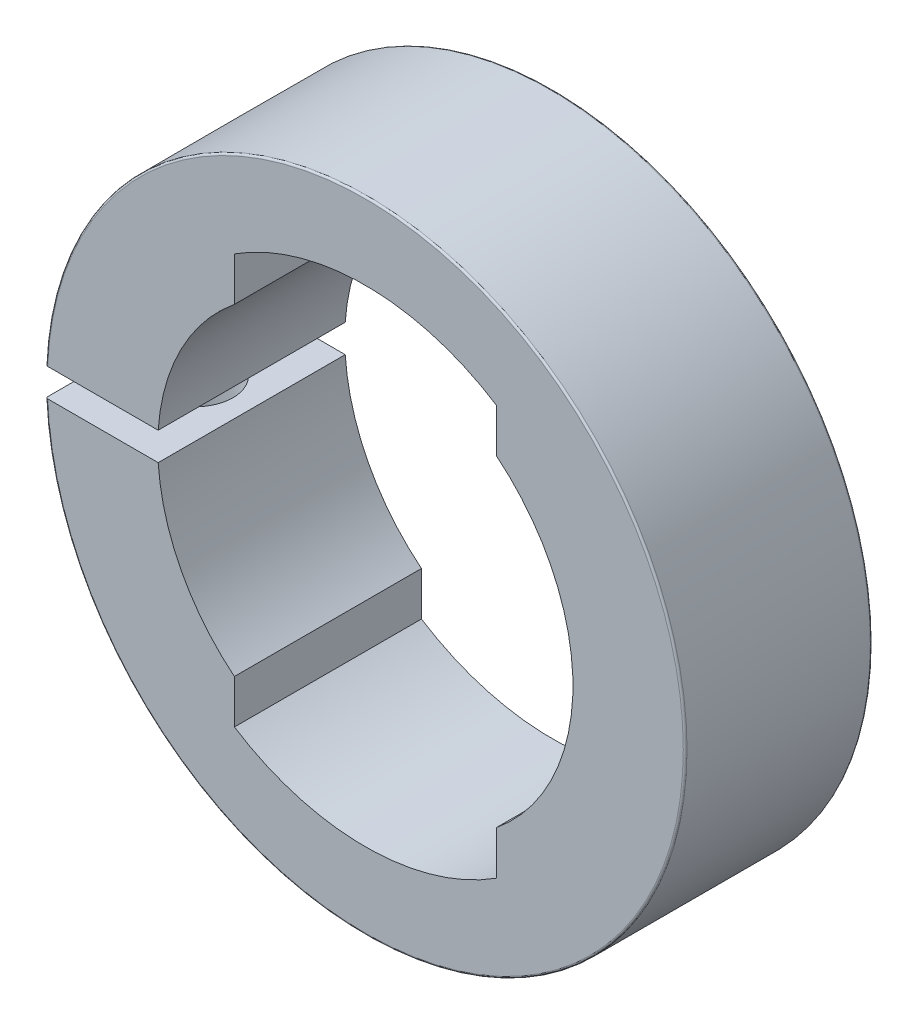
from build123d import *

# Parameters (mm, degrees)
BOSS_EXTRUDE1_DEPTH     = 10
CUT_EXTRUDE1_DEPTH      = 27.665192668
CUT_EXTRUDE1_DEPTH_BACK = 27.665192668
SKETCH2_R               = 2
FILLET1_R               = 0.1


with BuildPart() as part:
    # Sketch1 → Boss-Extrude1 (new body)
    with BuildSketch(Plane.XY):
        with BuildLine():
            Line((-7, 10.95445115), (-7, 8.614522622))
            ThreePointArc((-7, 8.614522622), (-9.855748076, 5.106293163), (-11.074633177, 0.75))
            Line((-11.074633177, 0.75), (-17.083544714, 0.75))
            ThreePointArc((-17.083544714, 0.75), (17.1, 0), (-17.083544714, -0.75))
            Line((-17.083544714, -0.75), (-11.074633177, -0.75))
            ThreePointArc((-11.074633177, -0.75), (-9.855748076, -5.106293163), (-7, -8.614522622))
            Line((-7, -8.614522622), (-7, -10.95445115))
            ThreePointArc((-7, -10.95445115), (0, -13), (7, -10.95445115))
            Line((7, -10.95445115), (7, -8.614522622))
            ThreePointArc((7, -8.614522622), (11.1, 0), (7, 8.614522622))
            Line((7, 8.614522622), (7, 10.95445115))
            ThreePointArc((7, 10.95445115), (0, 13), (-7, 10.95445115))
        make_face()
    extrude(amount=BOSS_EXTRUDE1_DEPTH)

    # Sketch2 → Cut-Extrude1 (cut, two sides: drawn at the far end of the back side and taken through both)
    with BuildSketch(Plane(origin=(0, -0.75, 0), x_dir=(1, 0, 0), z_dir=(0, 1, 0)).offset(-CUT_EXTRUDE1_DEPTH_BACK)):
        with Locations((-14.079088945, -5)):
            Circle(SKETCH2_R)
    extrude(amount=CUT_EXTRUDE1_DEPTH + CUT_EXTRUDE1_DEPTH_BACK, mode=Mode.SUBTRACT)

    # Fillet1
    fillet1_edges = [part.edges().sort_by_distance(p)[0] for p in [
        (17.1, 0, 0),
        (17.1, 0, 10),
    ]]
    fillet(fillet1_edges, radius=FILLET1_R)


solid = part.part
